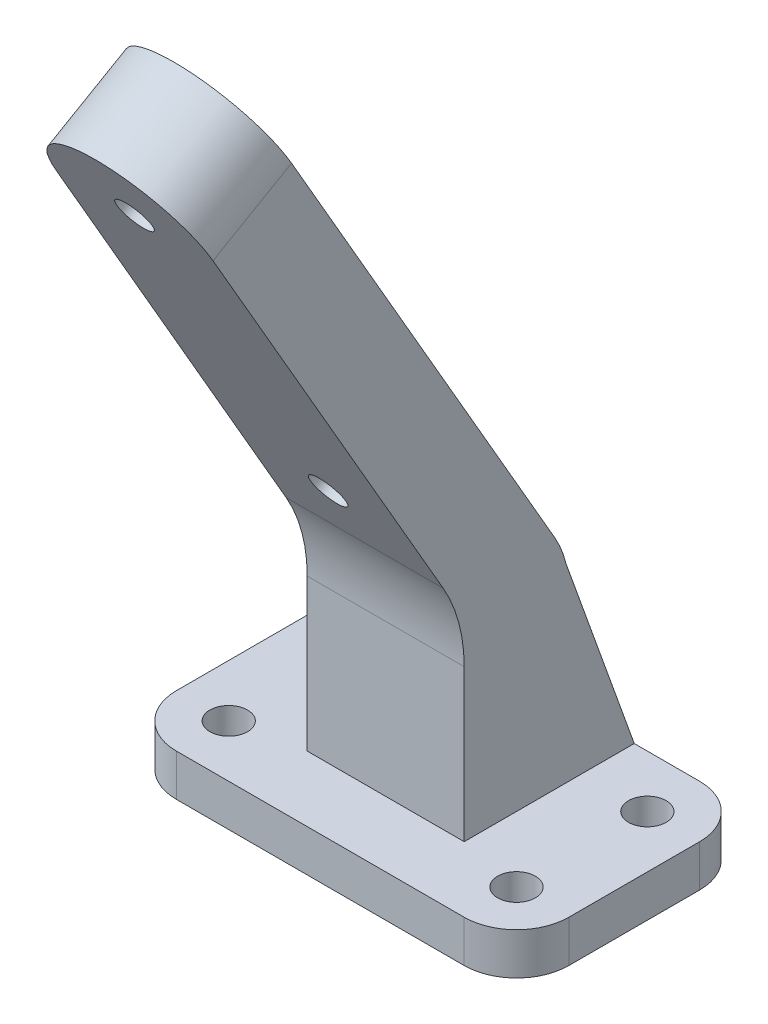
from build123d import *

# Parameters (mm, degrees)
SKETCH_1_W          = 37.5
SKETCH_1_H          = 22.5
EXTRUDE_2_DEPTH     = 4
SKETCH_2_W          = 15
SKETCH_2_H          = 10
EXTRUDE_3_DEPTH     = 18.5
EXTRUDE_4_DEPTH     = 15
EXTRUDE_5_DEPTH     = 8.66025404
SKETCH_5_R          = 1.7
CUT_EXTRUDE_1_DEPTH = 10
FILLET_1_R          = 15
FILLET_3_R          = 5
SKETCH_9_R          = 1.8
CUT_EXTRUDE_2_DEPTH = 4
FILLET_5_R          = 10
RIB_10_REACH        = 84.489
SKETCH_16_WALL_W    = 186.275176358
SKETCH_16_WALL_H    = 4
RIB_11_REACH        = 84.489
SKETCH_17_WALL_W    = 186.223541182
SKETCH_17_WALL_H    = 4


with BuildPart() as part:
    # 草图1 → 凸台-拉伸2 (new body)
    with BuildSketch(Plane(origin=(0, 0, 0), x_dir=(1, 0, 0), z_dir=(0, 1, 0))):
        with Locations((18.75, 11.25)):
            Rectangle(SKETCH_1_W, SKETCH_1_H)
    extrude(amount=EXTRUDE_2_DEPTH)

    # 草图2 → 凸台-拉伸3 (add)
    with BuildSketch(Plane(origin=(0, 4, 0), x_dir=(1, 0, 0), z_dir=(0, 1, 0))):
        with Locations((18.75, 11.25)):
            Rectangle(SKETCH_2_W, SKETCH_2_H)
    extrude(amount=EXTRUDE_3_DEPTH)

    # 草图3 → 凸台-拉伸4 (add)
    with BuildSketch(Plane(origin=(26.25, 0, 0), x_dir=(0, 0, -1), z_dir=(1, 0, 0))):
        Polygon((6.25, 22.5), (-17.75, 64.069219382), (-10.25, 68.399346401), (16.25, 22.5), align=None)
    extrude(amount=-EXTRUDE_4_DEPTH)

    # 草图4 → 凸台-拉伸5 (add)
    with BuildSketch(Plane(origin=(0, 8.331329387, -14.430285793), x_dir=(1, 0, 0), z_dir=(0, -0.5000000000000041, 0.8660254037844363))):
        with BuildLine():
            Line((26.25, 64.360571585), (11.25, 64.360571585))
            ThreePointArc((11.25, 64.360571585), (18.75, 71.860571585), (26.25, 64.360571585))
        make_face()
    extrude(amount=-EXTRUDE_5_DEPTH)

    # 草图5 → 切除-拉伸1 (cut)
    with BuildSketch(Plane(origin=(0, 8.331329387, -14.430285793), x_dir=(1, 0, 0), z_dir=(0, -0.5000000000000041, 0.8660254037844363))):
        with Locations((18.75, 64.360571585)):
            Circle(SKETCH_5_R)
        with Locations((18.75, 27.360571585)):
            Circle(SKETCH_5_R)
    extrude(amount=-CUT_EXTRUDE_1_DEPTH, mode=Mode.SUBTRACT)

    # 圆角1
    fillet_1_edges = [part.edges().sort_by_distance(p)[0] for p in [
        (18.75, 22.5, -6.25),
    ]]
    fillet(fillet_1_edges, radius=FILLET_1_R)

    # 圆角3
    fillet_3_edges = [part.edges().sort_by_distance(p)[0] for p in [
        (37.5, 2, 0),
        (37.5, 2, -22.5),
        (0, 2, 0),
        (0, 2, -22.5),
    ]]
    fillet(fillet_3_edges, radius=FILLET_3_R)

    # 草图9 → 切除-拉伸2 (cut)
    with BuildSketch(Plane(origin=(0, 4, 0), x_dir=(1, 0, 0), z_dir=(0, 1, 0))):
        with Locations((5, 17.5)):
            Circle(SKETCH_9_R)
        with Locations((32.5, 17.5)):
            Circle(SKETCH_9_R)
        with Locations((32.5, 5)):
            Circle(SKETCH_9_R)
        with Locations((5, 5)):
            Circle(SKETCH_9_R)
    extrude(amount=-CUT_EXTRUDE_2_DEPTH, mode=Mode.SUBTRACT)

    # 圆角5
    fillet_5_edges = [part.edges().sort_by_distance(p)[0] for p in [
        (18.75, 22.5, -16.25),
    ]]
    fillet(fillet_5_edges, radius=FILLET_5_R)

    # 草图16 wall → 筋10 (add, up to next)
    with BuildSketch(Plane(origin=(26.25, 13.079426042, -19.236382193), x_dir=(0, 0.941051653324, 0.33826289447), z_dir=(0, -0.33826289447, 0.941051653324)), mode=Mode.PRIVATE) as rib_10_sk1:
        with Locations((0, 2)):
            Rectangle(SKETCH_16_WALL_W, SKETCH_16_WALL_H)
    rib_10_tool1 = extrude(rib_10_sk1.sketch, amount=RIB_10_REACH, mode=Mode.PRIVATE) - part.part
    add(rib_10_tool1.solids().sort_by_distance((26.25, 13.079426042, -19.236382193))[0])

    # 草图17 wall → 筋11 (add, up to next)
    with BuildSketch(Plane(origin=(11.25, 13.054150816, -19.242391515), x_dir=(0, 0.940949854763, 0.338545965597), z_dir=(0, 0.338545965597, -0.940949854763)), mode=Mode.PRIVATE) as rib_11_sk1:
        with Locations((0, 2)):
            Rectangle(SKETCH_17_WALL_W, SKETCH_17_WALL_H)
    rib_11_tool1 = extrude(rib_11_sk1.sketch, amount=-RIB_11_REACH, mode=Mode.PRIVATE) - part.part
    add(rib_11_tool1.solids().sort_by_distance((11.25, 13.054150816, -19.242391515))[0])


solid = part.part
